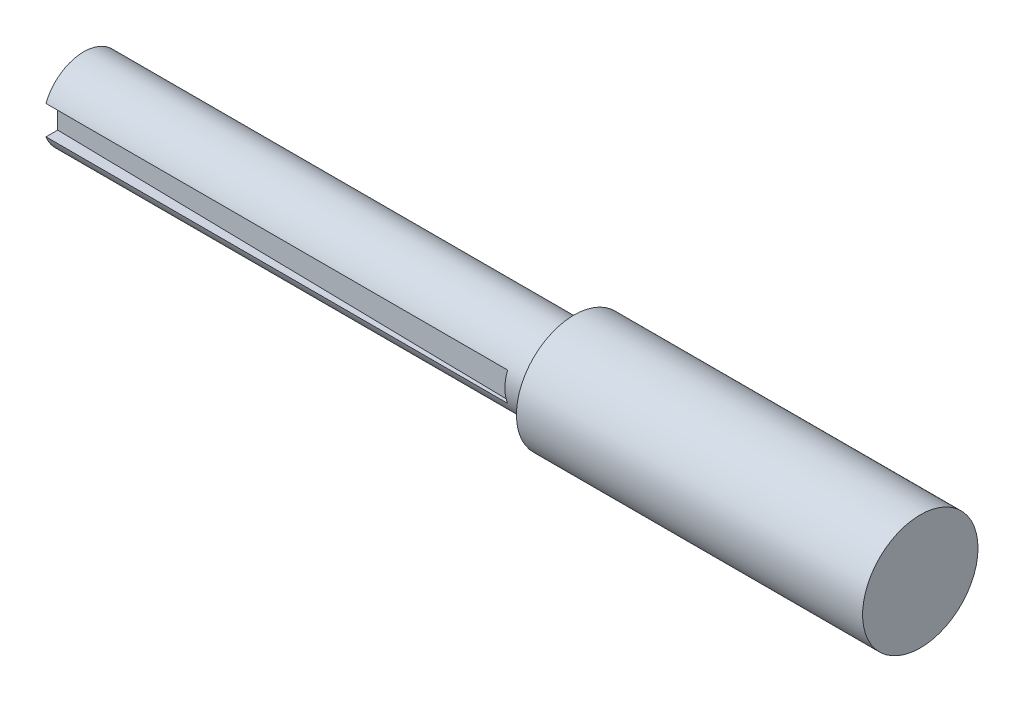
from build123d import *

# Parameters (mm, degrees)
SKETCH1_R           = 10
BOSS_EXTRUDE1_DEPTH = 145
SKETCH2_R           = 10
SKETCH2_R_2         = 7
CUT_EXTRUDE1_DEPTH  = 97
FILLET1_R           = 1
CUT_LOFT1_START     = -2.5
CUT_LOFT1_DEPTH     = 5


# Read off the part's stored shape, not the designer's step: Cut-Loft1
with BuildPart() as part:
    # Sketch1 → Boss-Extrude1 (new body)
    with BuildSketch(Plane(origin=(0, 0, 0), x_dir=(0, 0, -1), z_dir=(1, 0, 0))):
        Circle(SKETCH1_R)
    extrude(amount=-BOSS_EXTRUDE1_DEPTH)

    # Sketch2 → Cut-Extrude1 (cut)
    with BuildSketch(Plane(origin=(-60, 0, 0), x_dir=(0, 0, -1), z_dir=(1, 0, 0))):
        Circle(SKETCH2_R)
        Circle(SKETCH2_R_2, mode=Mode.SUBTRACT)
    extrude(amount=-CUT_EXTRUDE1_DEPTH, mode=Mode.SUBTRACT)

    # Fillet1
    fillet1_edges = [part.edges().sort_by_distance(p)[0] for p in [
        (-60, 0, 7),
    ]]
    fillet(fillet1_edges, radius=FILLET1_R)

    # Cut-Loft1 outline → Cut-Loft1 (cut)
    with BuildSketch(Plane(origin=(0, 0, 0), x_dir=(1, 0, 0), z_dir=(0, 1, 0)).offset(CUT_LOFT1_START)):
        Polygon((-65, -8), (-65, -6.008348415), (-145, -4.508348415), (-145, -8), align=None)
    extrude(amount=CUT_LOFT1_DEPTH, mode=Mode.SUBTRACT)


solid = part.part
